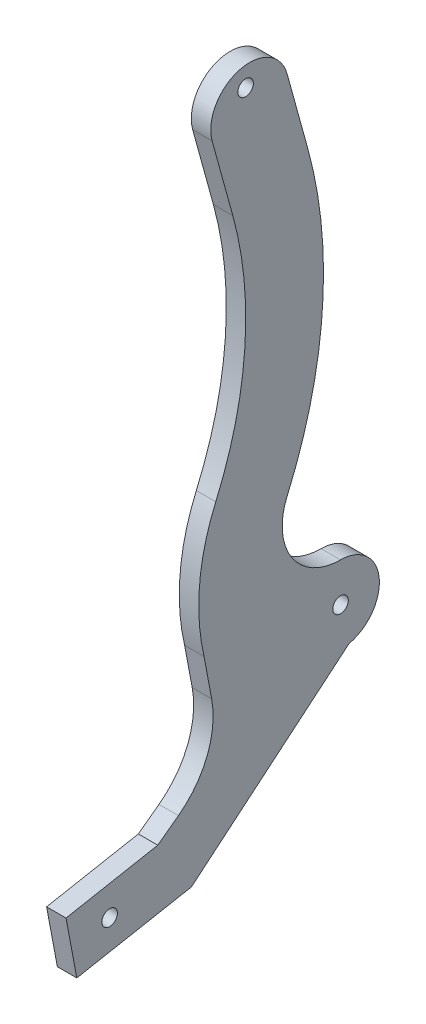
from build123d import *

# Parameters (mm, degrees)
SKETCH1_R           = 2.54
BOSS_EXTRUDE1_DEPTH = 6.35
SKETCH2_R           = 2.54
BOSS_EXTRUDE2_DEPTH = 6.35


with BuildPart() as part:
    # Sketch1 → Boss-Extrude1 (new body)
    with BuildSketch(Plane(origin=(0, 0, 0), x_dir=(0, 0, -1), z_dir=(1, 0, 0))):
        with BuildLine():
            Line((-44.569856196, 7.632792855), (2.7669164, -12.394925318))
            ThreePointArc((2.7669164, -12.394925318), (12.623500932, 1.391842028), (0, 12.7))
            ThreePointArc((0, 12.7), (-15.936201096, 21.312567622), (-17.462784388, 39.362730221))
            ThreePointArc((-17.462784388, 39.362730221), (-5.921340573, 86.302722272), (-10.695095154, 134.404479477))
            Line((-10.695095154, 134.404479477), (-17.44376381, 158.89152649))
            ThreePointArc((-17.44376381, 158.89152649), (-33.061621644, 167.760715668), (-41.930810822, 152.142857834))
            Line((-41.930810822, 152.142857834), (-38.556476494, 139.899334328))
            Line((-38.556476494, 139.899334328), (-35.182142166, 127.655810822))
            ThreePointArc((-35.182142166, 127.655810822), (-31.257188906, 88.106825725), (-40.746496905, 49.513037183))
            ThreePointArc((-40.746496905, 49.513037183), (-46.038128876, 28.881479889), (-44.569856196, 7.632792855))
        make_face()
        Circle(SKETCH1_R, mode=Mode.SUBTRACT)
        with Locations((-31.007118959, 161.740192162)):
            Circle(SKETCH1_R, mode=Mode.SUBTRACT)
    extrude(amount=BOSS_EXTRUDE1_DEPTH)

    # Sketch2 → Boss-Extrude2 (add)
    with BuildSketch(Plane(origin=(6.35, 0, 0), x_dir=(0, 0, -1), z_dir=(1, 0, 0))):
        with BuildLine():
            Line((-44.569856196, 7.632792855), (-42.095309311, -5.538639039))
            ThreePointArc((-42.095309311, -5.538639039), (-43.548594954, -20.911029153), (-52.944669407, -33.164037021))
            Line((-52.944669407, -33.164037021), (-59.696430917, -38.15584))
            Line((-59.696430917, -38.15584), (-89.652353277, -43.783727307))
            Line((-89.652353277, -43.783727307), (-86.13492371, -62.506178782))
            Line((-86.13492371, -62.506178782), (-48.69002076, -55.471319649))
            Line((-48.69002076, -55.471319649), (2.7669164, -12.394925318))
            Line((2.7669164, -12.394925318), (-44.569856196, 7.632792855))
        make_face()
        with Locations((-75.412004177, -50.8)):
            Circle(SKETCH2_R, mode=Mode.SUBTRACT)
    extrude(amount=-BOSS_EXTRUDE2_DEPTH)


solid = part.part
